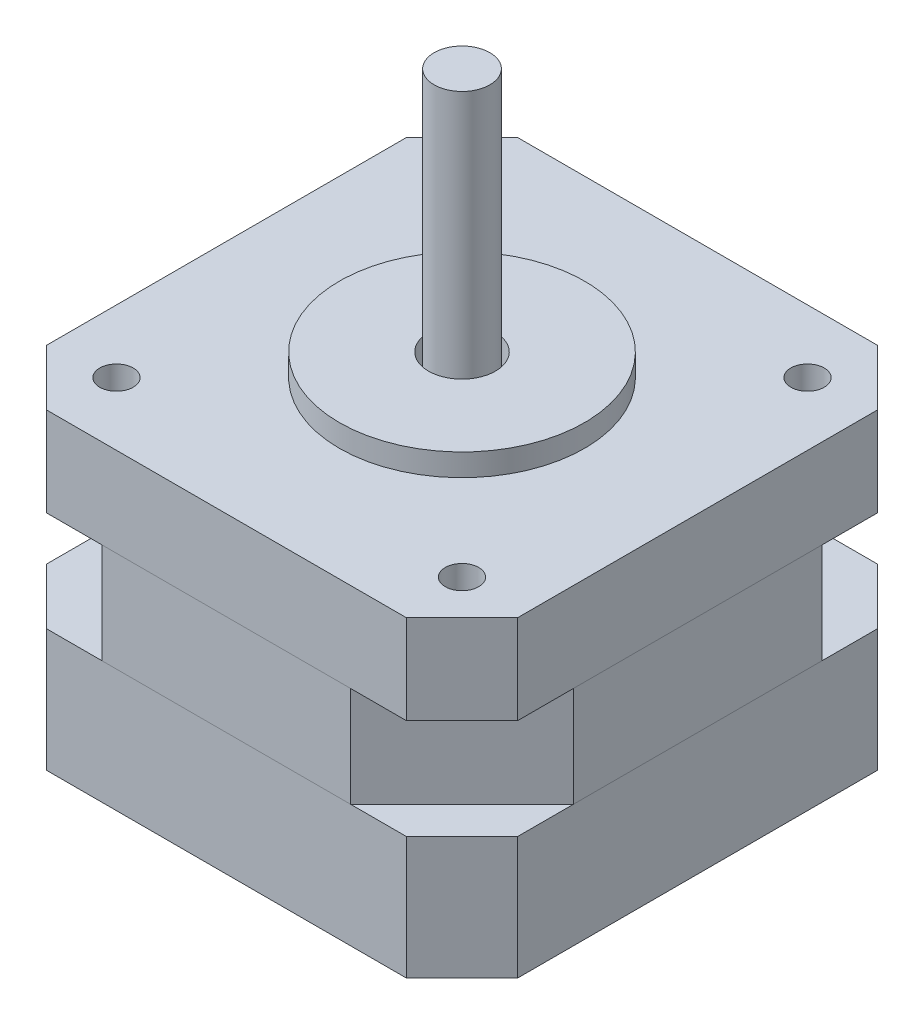
from build123d import *

# Parameters (mm, degrees)
SKETCH1_W           = 42.3
SKETCH1_H           = 42.3
BOSS_EXTRUDE1_DEPTH = 11
SKETCH2_W           = 42.3
SKETCH2_H           = 42.3
BOSS_EXTRUDE2_DEPTH = 9
SKETCH3_W           = 42.3
SKETCH3_H           = 42.3
BOSS_EXTRUDE3_DEPTH = 8
CHAMFER1_SIZE       = 10
CHAMFER2_SIZE       = 5
CHAMFER3_SIZE       = 5
SKETCH4_R           = 11
BOSS_EXTRUDE4_DEPTH = 2
SKETCH5_R           = 3
CUT_EXTRUDE1_DEPTH  = 4
SKETCH6_R           = 2.5
BOSS_EXTRUDE5_DEPTH = 26
SKETCH7_R           = 1.5
CUT_EXTRUDE2_DEPTH  = 4.5


with BuildPart() as part:
    # Sketch1 → Boss-Extrude1 (new body)
    with BuildSketch(Plane(origin=(0, 0, 0), x_dir=(1, 0, 0), z_dir=(0, 1, 0))):
        Rectangle(SKETCH1_W, SKETCH1_H)
    extrude(amount=BOSS_EXTRUDE1_DEPTH)

    # Chamfer3
    chamfer3_edges = [part.edges().sort_by_distance(p)[0] for p in [
        (-21.15, 5.5, 21.15),
        (21.15, 5.5, 21.15),
        (21.15, 5.5, -21.15),
        (-21.15, 5.5, -21.15),
    ]]
    chamfer(chamfer3_edges, length=CHAMFER3_SIZE)


with BuildPart() as body_2:
    # Sketch2 → Boss-Extrude2 (new body)
    with BuildSketch(Plane(origin=(0, 11, 0), x_dir=(1, 0, 0), z_dir=(0, 1, 0))):
        Rectangle(SKETCH2_W, SKETCH2_H)
    extrude(amount=BOSS_EXTRUDE2_DEPTH)

    # Chamfer1
    chamfer1_edges = [body_2.edges().sort_by_distance(p)[0] for p in [
        (-21.15, 15.5, -21.15),
        (21.15, 15.5, -21.15),
        (21.15, 15.5, 21.15),
        (-21.15, 15.5, 21.15),
    ]]
    chamfer(chamfer1_edges, length=CHAMFER1_SIZE)


with BuildPart() as body_3:
    # Sketch3 → Boss-Extrude3 (new body)
    with BuildSketch(Plane(origin=(0, 20, 0), x_dir=(1, 0, 0), z_dir=(0, 1, 0))):
        Rectangle(SKETCH3_W, SKETCH3_H)
    extrude(amount=BOSS_EXTRUDE3_DEPTH)

    # Chamfer2
    chamfer2_edges = [body_3.edges().sort_by_distance(p)[0] for p in [
        (21.15, 24, -21.15),
        (-21.15, 24, -21.15),
        (-21.15, 24, 21.15),
        (21.15, 24, 21.15),
    ]]
    chamfer(chamfer2_edges, length=CHAMFER2_SIZE)

    # Sketch4 → Boss-Extrude4 (add)
    with BuildSketch(Plane(origin=(0, 28, 0), x_dir=(1, 0, 0), z_dir=(0, 1, 0))):
        Circle(SKETCH4_R)
    extrude(amount=BOSS_EXTRUDE4_DEPTH)

    # Sketch5 → Cut-Extrude1 (cut)
    with BuildSketch(Plane(origin=(0, 30, 0), x_dir=(1, 0, 0), z_dir=(0, 1, 0))):
        Circle(SKETCH5_R)
    extrude(amount=-CUT_EXTRUDE1_DEPTH, mode=Mode.SUBTRACT)

    # Sketch6 → Boss-Extrude5 (add)
    with BuildSketch(Plane(origin=(0, 26, 0), x_dir=(1, 0, 0), z_dir=(0, 1, 0))):
        Circle(SKETCH6_R)
    extrude(amount=BOSS_EXTRUDE5_DEPTH)

    # Sketch7 → Cut-Extrude2 (cut)
    with BuildSketch(Plane(origin=(0, 28, 0), x_dir=(1, 0, 0), z_dir=(0, 1, 0))):
        with Locations((-15.5, -15.5)):
            Circle(SKETCH7_R)
        with Locations((-15.5, 15.5)):
            Circle(SKETCH7_R)
        with Locations((15.5, 15.5)):
            Circle(SKETCH7_R)
        with Locations((15.5, -15.5)):
            Circle(SKETCH7_R)
    extrude(amount=-CUT_EXTRUDE2_DEPTH, mode=Mode.SUBTRACT)


solid = Compound([part.part, body_2.part, body_3.part])
